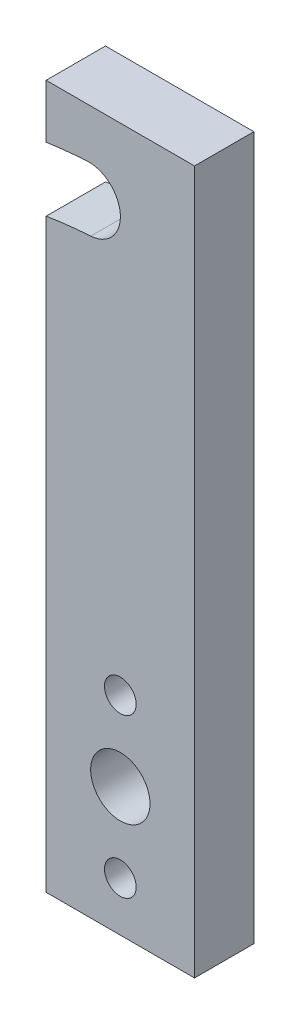
from build123d import *

# Parameters (mm, degrees)
ESBO_O1_R                = 1.6
ESBO_O1_R_2              = 3
RESSALTO_EXTRUS_O1_DEPTH = 6


with BuildPart() as part:
    # Esboço1 → Ressalto-extrusão1 (new body)
    with BuildSketch(Plane.XY):
        with BuildLine():
            Line((-7.5, 23.64943963), (-7.5, -35.545689984))
            Line((-7.5, -35.545689984), (7.5, -35.545689984))
            Line((7.5, -35.545689984), (7.5, 35.545689984))
            Line((7.5, 35.545689984), (-7.5, 35.545689984))
            Line((-7.5, 35.545689984), (-7.5, 30.122991413))
            ThreePointArc((-7.5, 30.122991413), (-5.453021457, 30.374103638), (-3.397848318, 30.545689984))
            ThreePointArc((-3.397848318, 30.545689984), (0, 27.556605373), (-2.98908461, 24.158757055))
            ThreePointArc((-2.98908461, 24.158757055), (-5.250721384, 23.958825119), (-7.5, 23.64943963))
        make_face()
        with Locations((0, -30.545689984)):
            Circle(ESBO_O1_R, mode=Mode.SUBTRACT)
        with Locations((0, -22.545689984)):
            Circle(ESBO_O1_R_2, mode=Mode.SUBTRACT)
        with Locations((0, -14.545689984)):
            Circle(ESBO_O1_R, mode=Mode.SUBTRACT)
    extrude(amount=RESSALTO_EXTRUS_O1_DEPTH)


solid = part.part
